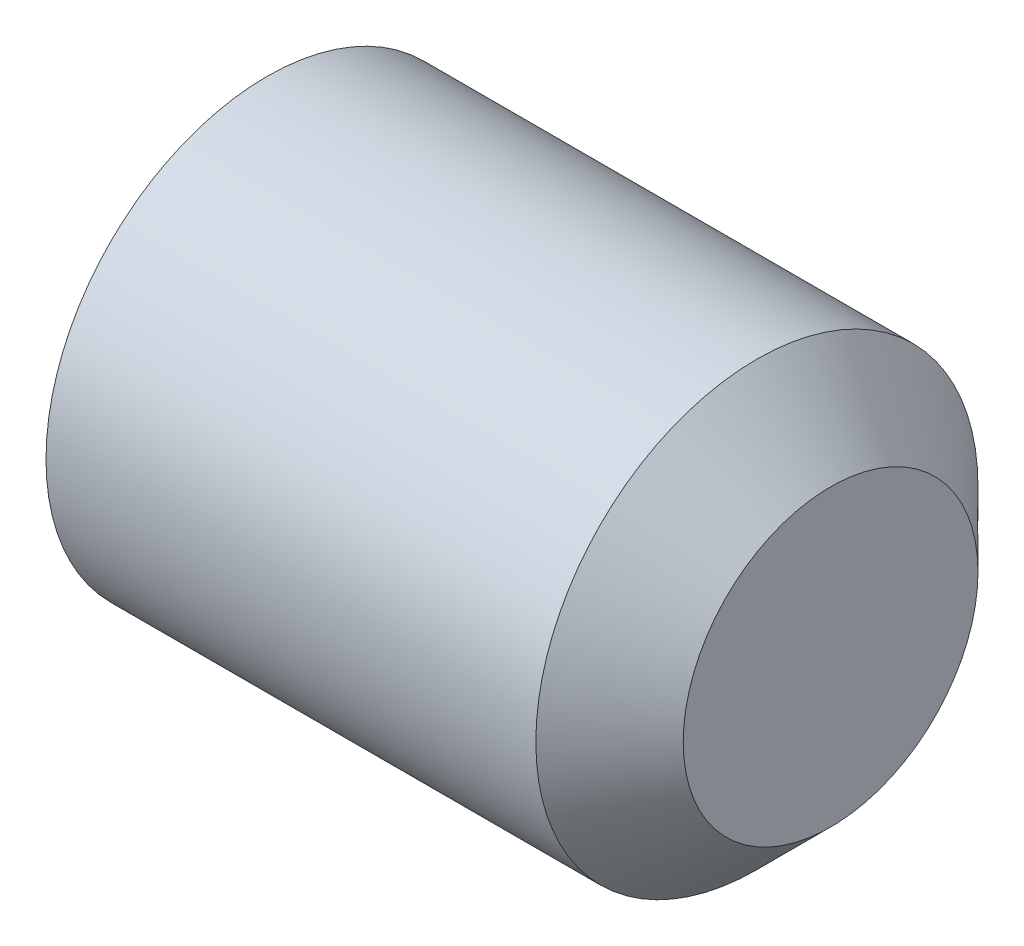
from build123d import *

# Parameters (mm, degrees)
CUT_EXTRUDE1_DEPTH = 1.2


with BuildPart() as part:
    # Sketch1 → Revolve1 (revolve)
    with BuildSketch(Plane.XY):
        Polygon((0, 0), (0, 1), (-0.5, 1.5), (-3.823330818, 1.5), (-4, 1.194), (-4, 0), align=None)
    revolve(axis=Axis((-4, 0, 0), (1, 0, 0)))

    # Sketch2 → Cut-Extrude1 (cut)
    with BuildSketch(Plane(origin=(-4, 0, 0), x_dir=(0, 0, -1), z_dir=(1, 0, 0))):
        Polygon((0.75, -0.433012702), (0.75, 0.433012702), (0, 0.866025404), (-0.75, 0.433012702), (-0.75, -0.433012702), (0, -0.866025404), align=None)
    extrude(amount=CUT_EXTRUDE1_DEPTH, mode=Mode.SUBTRACT)


solid = part.part
